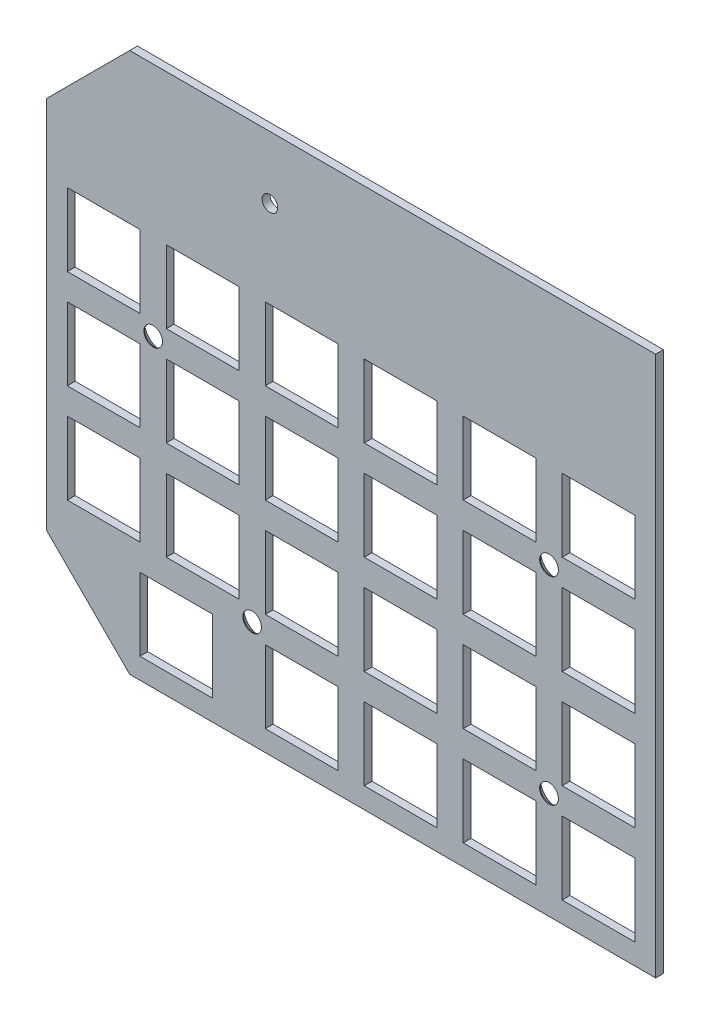
from build123d import *

# Parameters (mm, degrees)
BOSS_EXTRU_1_DEPTH                          = 1.5
ESQUISSE3_R                                 = 1.5
ESQUISSE3_W                                 = 14
ESQUISSE3_H                                 = 14
ENL_V_MAT_EXTRU_2_DEPTH                     = 10
FRAISAGE_POUR_VIS_T_TE_FRAIS_E_M31_AT_COUNT = 2
FRAISAGE_POUR_VIS_T_TE_FRAIS_E_M31_AT_PITCH = 38.1
FRAISAGE_POUR_VIS_T_TE_FRAIS_E_M31_2_COUNT  = 2
FRAISAGE_POUR_VIS_T_TE_FRAIS_E_M31_2_PITCH  = 76.2
FRAISAGE_POUR_VIS_T_TE_FRAIS_E_M31_3_COUNT  = 2
FRAISAGE_POUR_VIS_T_TE_FRAIS_E_M31_3_PITCH  = 68.685751798


with BuildPart() as part:
    # Esquisse1 → Boss.-Extru.1 (new body)
    with BuildSketch(Plane.XY):
        Polygon((0, -85), (16, -101), (117.25, -101), (117.25, 3), (16, 3), (0, -13), align=None)
    extrude(amount=BOSS_EXTRU_1_DEPTH)

    # Esquisse3 → Enlèv. mat.-Extru.2 (cut)
    with BuildSketch(Plane(origin=(0, 0, 0), x_dir=(-1, 0, 0), z_dir=(0, 0, -1))):
        with Locations((-43, -9)):
            Circle(ESQUISSE3_R)
        with Locations((-87.2, -32.85)):
            Rectangle(ESQUISSE3_W, ESQUISSE3_H)
        with Locations((-106.25, -32.85)):
            Rectangle(ESQUISSE3_W, ESQUISSE3_H)
        with Locations((-68.15, -32.85)):
            Rectangle(ESQUISSE3_W, ESQUISSE3_H)
        with Locations((-49.1, -32.85)):
            Rectangle(ESQUISSE3_W, ESQUISSE3_H)
        with Locations((-30.05, -32.85)):
            Rectangle(ESQUISSE3_W, ESQUISSE3_H)
        with Locations((-11, -32.85)):
            Rectangle(ESQUISSE3_W, ESQUISSE3_H)
        with Locations((-87.2, -51.9)):
            Rectangle(ESQUISSE3_W, ESQUISSE3_H)
        with Locations((-68.15, -51.9)):
            Rectangle(ESQUISSE3_W, ESQUISSE3_H)
        with Locations((-49.1, -51.9)):
            Rectangle(ESQUISSE3_W, ESQUISSE3_H)
        with Locations((-30.05, -51.9)):
            Rectangle(ESQUISSE3_W, ESQUISSE3_H)
        with Locations((-11, -51.9)):
            Rectangle(ESQUISSE3_W, ESQUISSE3_H)
        with Locations((-87.2, -70.95)):
            Rectangle(ESQUISSE3_W, ESQUISSE3_H)
        with Locations((-68.15, -70.95)):
            Rectangle(ESQUISSE3_W, ESQUISSE3_H)
        with Locations((-49.1, -70.95)):
            Rectangle(ESQUISSE3_W, ESQUISSE3_H)
        with Locations((-30.05, -70.95)):
            Rectangle(ESQUISSE3_W, ESQUISSE3_H)
        with Locations((-11, -70.95)):
            Rectangle(ESQUISSE3_W, ESQUISSE3_H)
        with Locations((-87.2, -90)):
            Rectangle(ESQUISSE3_W, ESQUISSE3_H)
        with Locations((-68.15, -90)):
            Rectangle(ESQUISSE3_W, ESQUISSE3_H)
        with Locations((-49.1, -90)):
            Rectangle(ESQUISSE3_W, ESQUISSE3_H)
        with Locations((-106.25, -51.9)):
            Rectangle(ESQUISSE3_W, ESQUISSE3_H)
        with Locations((-106.25, -70.95)):
            Rectangle(ESQUISSE3_W, ESQUISSE3_H)
        with Locations((-106.25, -90)):
            Rectangle(ESQUISSE3_W, ESQUISSE3_H)
        with Locations((-24.97, -90)):
            Rectangle(ESQUISSE3_W, ESQUISSE3_H)
    extrude(amount=-ENL_V_MAT_EXTRU_2_DEPTH, mode=Mode.SUBTRACT)

    # Esquisse6 → Fraisage pour vis à tête fraisée M31 (revolve, cut)
    with BuildSketch(Plane(origin=(96.725, -42.375, 0), x_dir=(0, 1, 0), z_dir=(1, 0, 0))):
        Polygon((0, 0), (0, 1.5), (1.8, 1.5), (1.8, 1.35), (3.15, 0), align=None)
    fraisage_pour_vis_t_te_frais_e_m31 = revolve(axis=Axis((96.725, -42.375, -6.35), (0, 0, 1)), mode=Mode.SUBTRACT)

    # Fraisage pour vis à tête fraisée M31 at: Fraisage pour vis à tête fraisée M31 ×2
    with Locations(*[(0, -i * FRAISAGE_POUR_VIS_T_TE_FRAIS_E_M31_AT_PITCH, 0) for i in range(1, FRAISAGE_POUR_VIS_T_TE_FRAIS_E_M31_AT_COUNT)]):
        add(fraisage_pour_vis_t_te_frais_e_m31, mode=Mode.SUBTRACT)

    # Fraisage pour vis _ t_te frais_e M31 2: Fraisage pour vis à tête fraisée M31 ×2
    with Locations(*[(-i * FRAISAGE_POUR_VIS_T_TE_FRAIS_E_M31_2_PITCH, 0, 0) for i in range(1, FRAISAGE_POUR_VIS_T_TE_FRAIS_E_M31_2_COUNT)]):
        add(fraisage_pour_vis_t_te_frais_e_m31, mode=Mode.SUBTRACT)

    # Fraisage pour vis _ t_te frais_e M31 3: Fraisage pour vis à tête fraisée M31 ×2
    with Locations(*[Vector(-0.8320502943378435, -0.5547001962252295, 0) * (i * FRAISAGE_POUR_VIS_T_TE_FRAIS_E_M31_3_PITCH) for i in range(1, FRAISAGE_POUR_VIS_T_TE_FRAIS_E_M31_3_COUNT)]):
        add(fraisage_pour_vis_t_te_frais_e_m31, mode=Mode.SUBTRACT)


solid = part.part
